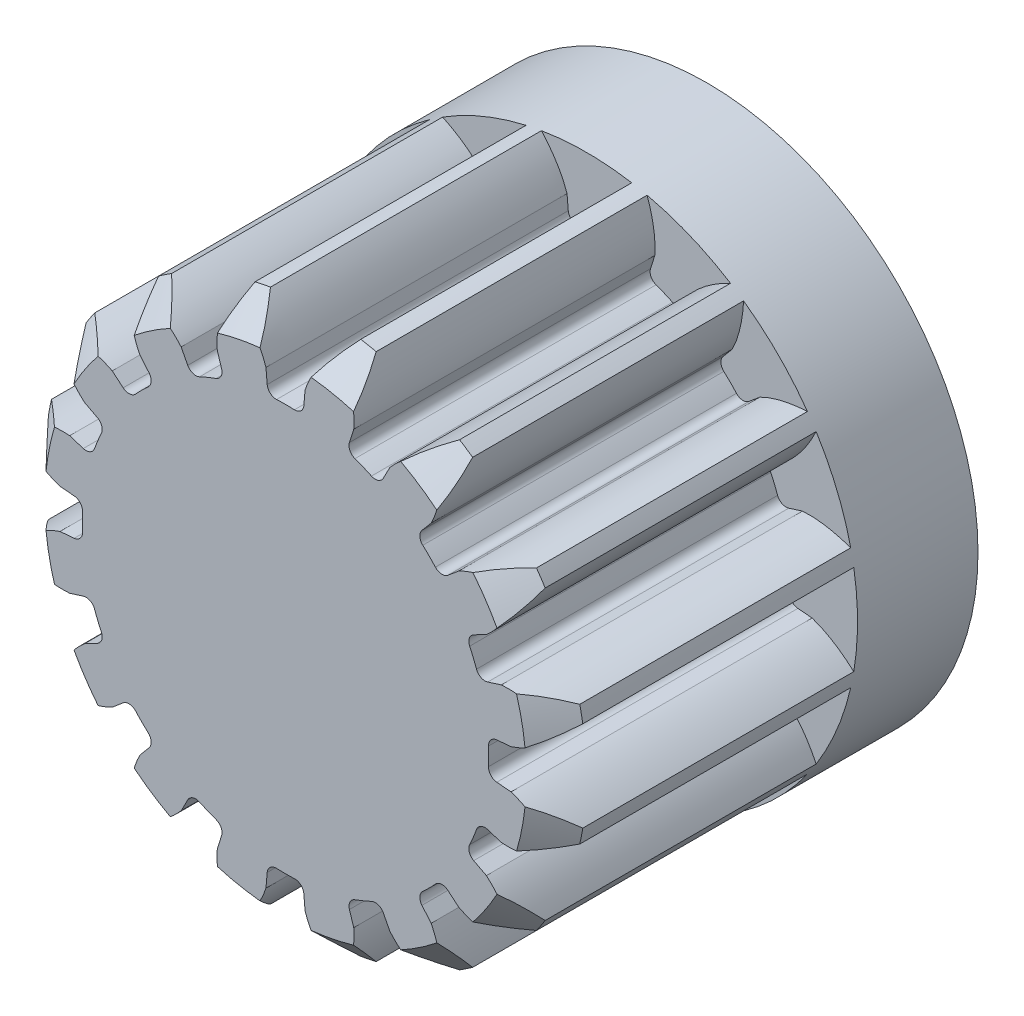
from build123d import *
from build123d.topology import SkipClean

# Parameters (mm, degrees)
SKETCH_1000_R                    = 9
EXTRUDE_1020_DEPTH               = 5.5
CHAMFER_1059_SIZE                = 1
CUT_EXTRUDE_1368_DEPTH           = 5.5
FILLET_1_R                       = 0.3
PATTERN_CIRCULAR_1_COUNT         = 16
FILLET_1_OF_PATTERN_CIRCULAR_1_R = 0.3
EXTRUDE_START                    = -1
SKETCH_3_R                       = 9
EXTRUDE_1_DEPTH                  = 4
CUT_EXTRUDE_1_DEPTH              = 19.920888024
SCALE_1_SCALE                    = 1.5
EXTRUDE_2_DEPTH                  = 3
CUT_EXTRUDE_2_REACH              = 30.382
EXTRUDE_START_2                  = -3
EXTRUDE_3_DEPTH                  = 3


with BuildPart() as part:
    # Sketch 1000 → Extrude 1020 (new, symmetric)
    with BuildSketch(Plane.XY):
        Circle(SKETCH_1000_R)
    extrude(amount=EXTRUDE_1020_DEPTH, both=True)

    # Chamfer 1059
    chamfer_1059_edges = [part.edges().sort_by_distance(p)[0] for p in [
        (-9, 0, -5.5),
        (-9, 0, 5.5),
    ]]
    chamfer(chamfer_1059_edges, length=CHAMFER_1059_SIZE)

    # 草图2 → Cut-Extrude 1368 (cut, symmetric)
    with BuildSketch(Plane.XY):
        with BuildLine():
            Line((-0.649521906, 7.489428782), (-0.583205717, 6.724758069))
            ThreePointArc((-0.583205717, 6.724758069), (0, 6.75), (0.583205717, 6.724758069))
            Line((0.583205717, 6.724758069), (0.649521906, 7.489428782))
            add(Edge.make_bspline(
                [(0.649521906, 7.489428782), (0.6695115, 7.551718906), (0.740362588, 7.746790618), (0.911645236, 8.10353835), (1.138900001, 8.445575752), (1.355282175, 8.713087543), (1.489796782, 8.863385073), (1.499543153, 8.874196884)],
                knots=[0.009155267, 0.009155267, 0.009155267, 0.009155267, 0.009155267, 0.015718248, 0.029959916, 0.048733667, 0.050193918, 0.050193918, 0.050193918, 0.050193918, 0.050193918], degree=4))
            ThreePointArc((1.499543153, 8.874196884), (-1e-09, 9), (-1.499543154, 8.874196884))
            add(Edge.make_bspline(
                [(-0.649521906, 7.489428782), (-0.6695115, 7.551718905), (-0.740362587, 7.746790616), (-0.911645235, 8.103538347), (-1.1389, 8.445575749), (-1.355282175, 8.713087542), (-1.489796783, 8.863385072), (-1.499543154, 8.874196884)],
                knots=[0.009155267, 0.009155267, 0.009155267, 0.009155267, 0.009155267, 0.015718248, 0.029959916, 0.048733667, 0.050193918, 0.050193918, 0.050193918, 0.050193918, 0.050193918], degree=4))
        make_face()
    cut_extrude_1368 = extrude(amount=CUT_EXTRUDE_1368_DEPTH, both=True, mode=Mode.SUBTRACT)

    # 圆角1
    fillet_1_edges = [part.edges().sort_by_distance(p)[0] for p in [
        (0.583205717, 6.724758069, 0),
        (-0.583205717, 6.724758069, 0),
    ]]
    fillet(fillet_1_edges, radius=FILLET_1_R)

    # 圆周阵列1: Cut-Extrude 1368 ×16 about axis
    pattern_circular_1_axis = Axis((0, 0, 5.5), (0, 0, -1))
    for i in range(1, PATTERN_CIRCULAR_1_COUNT):
        add(cut_extrude_1368.rotate(pattern_circular_1_axis, i * 360 / PATTERN_CIRCULAR_1_COUNT), mode=Mode.SUBTRACT)

    # 圆角1 of 圆周阵列1
    fillet_1_of_pattern_circular_1_edges = [part.edges().sort_by_distance(p)[0] for p in [
        (3.112265325, 5.989683176, 0),
        (2.034641675, 6.436049507, 0),
        (5.16751075, 4.342733316, 0),
        (4.342733316, 5.16751075, 0),
        (6.436049507, 2.034641675, 0),
        (5.989683176, 3.112265325, 0),
        (6.724758069, -0.583205717, 0),
        (6.724758069, 0.583205717, 0),
        (5.989683176, -3.112265325, 0),
        (6.436049507, -2.034641675, 0),
        (4.342733316, -5.16751075, 0),
        (5.16751075, -4.342733316, 0),
        (2.034641675, -6.436049507, 0),
        (3.112265325, -5.989683176, 0),
        (-0.583205717, -6.724758069, 0),
        (0.583205717, -6.724758069, 0),
        (-3.112265325, -5.989683176, 0),
        (-2.034641675, -6.436049507, 0),
        (-5.16751075, -4.342733316, 0),
        (-4.342733316, -5.16751075, 0),
        (-6.436049507, -2.034641675, 0),
        (-5.989683176, -3.112265325, 0),
        (-6.724758069, 0.583205717, 0),
        (-6.724758069, -0.583205717, 0),
        (-5.989683176, 3.112265325, 0),
        (-6.436049507, 2.034641675, 0),
        (-4.342733316, 5.16751075, 0),
        (-5.16751075, 4.342733316, 0),
        (-2.034641675, 6.436049507, 0),
        (-3.112265325, 5.989683176, 0),
    ]]
    fillet(fillet_1_of_pattern_circular_1_edges, radius=FILLET_1_OF_PATTERN_CIRCULAR_1_R)

    # 草图3 → 凸台-拉伸1 (add)
    with SkipClean():  # the faces are left unmerged after this step: merging them gives an invalid solid
        with BuildSketch(Plane(origin=(0, 0, -5.5), x_dir=(-1, 0, 0), z_dir=(0, 0, -1)).offset(EXTRUDE_START)):
            Circle(SKETCH_3_R)
        extrude(amount=EXTRUDE_1_DEPTH)

    # 草图4 → 切除-拉伸1 (cut, through all)
    with SkipClean():  # the faces are left unmerged after this step: merging them gives an invalid solid
        with BuildSketch(Plane.XY.offset(5.5)):
            with BuildLine():
                Line((1.031180553, 1.266666667), (-1.031180553, 1.266666667))
                ThreePointArc((-1.031180553, 1.266666667), (-0.701254664, -1.475133782), (1.633333333, 0))
                ThreePointArc((1.633333333, 0), (1.475133782, 0.701254664), (1.031180553, 1.266666667))
            make_face()
        extrude(amount=-CUT_EXTRUDE_1_DEPTH, mode=Mode.SUBTRACT)


with BuildPart() as part_1:
    # 缩放比例1: scaled about (-5e-09, 0.003634113, -1.963696709)
    add(part.part.scale(SCALE_1_SCALE).moved(Location((3e-09, -0.001817057, 0.981848354))))

    # 草图5 → 凸台-拉伸2 (add)
    with BuildSketch(Plane.XY.offset(9.231847993)):
        with BuildLine():
            Line((-1.54677083, 1.898182944), (1.54677083, 1.898182944))
            ThreePointArc((1.54677083, 1.898182944), (0, -2.451817056), (-1.54677083, 1.898182944))
        make_face()
    extrude(amount=-EXTRUDE_2_DEPTH)

    # 草图7 → 切除-拉伸2 (cut, up to next)
    with BuildSketch(Plane(origin=(0, 0, -11.768152007), x_dir=(-1, 0, 0), z_dir=(0, 0, -1)), mode=Mode.PRIVATE) as cut_extrude_2_sk1:
        with BuildLine():
            Line((1.65, 2.2), (-1.65, 2.2))
            ThreePointArc((-1.65, 2.2), (0, -2.75), (1.65, 2.2))
        make_face()
    cut_extrude_2_tool1 = extrude(cut_extrude_2_sk1.sketch, amount=-CUT_EXTRUDE_2_REACH, mode=Mode.PRIVATE) & part_1.part
    add(cut_extrude_2_tool1.solids().sort_by_distance((0, -0.132971, -11.768152))[0], mode=Mode.SUBTRACT)

    # 草图8 → 凸台-拉伸3 (add)
    with BuildSketch(Plane.XY.offset(9.231847993).offset(EXTRUDE_START_2)):
        with BuildLine():
            Line((1.65, 2.2), (-1.65, 2.2))
            ThreePointArc((-1.65, 2.2), (0, -2.75), (1.65, 2.2))
        make_face()
    extrude(amount=EXTRUDE_3_DEPTH)


solid = part_1.part
